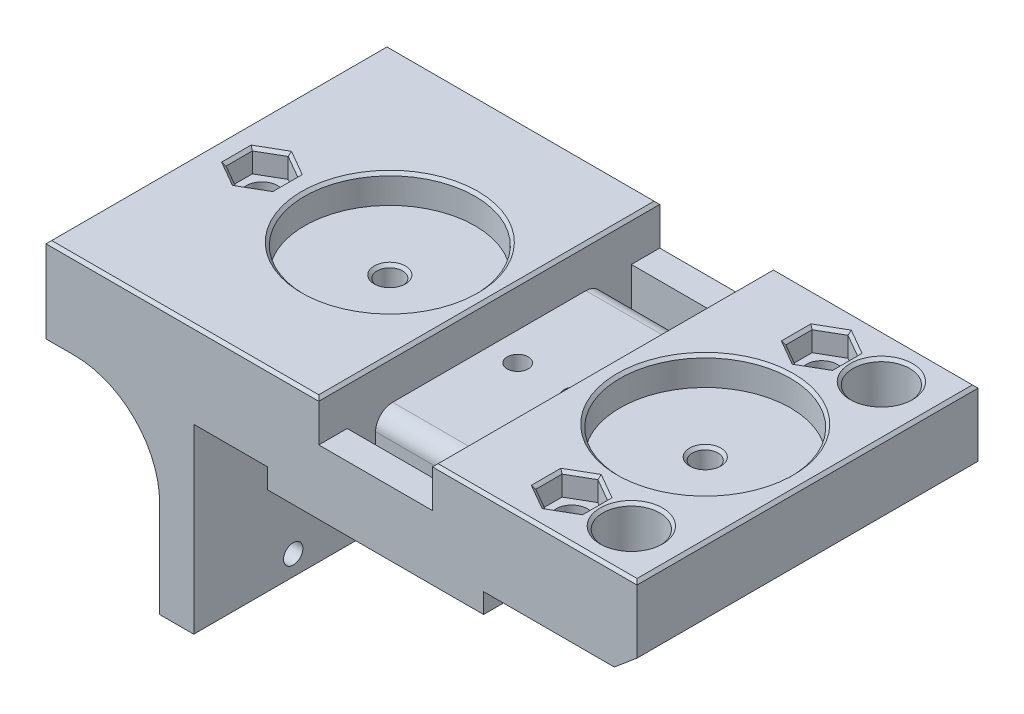
from build123d import *

# Parameters (mm, degrees)
SKETCH1_W                      = 84
SKETCH1_H                      = 60
BOSS_EXTRUDE1_DEPTH            = 15
SKETCH2_W                      = 6
SKETCH2_H                      = 60
BOSS_EXTRUDE2_DEPTH            = 32
M3_CLEARANCE_HOLE1_D           = 3.4
SKETCH7_W                      = 38
SKETCH7_H                      = 60
BOSS_EXTRUDE3_DEPTH            = 3.5
CUT_EXTRUDE5_START             = -7.147594
SKETCH26_W                     = 20
SKETCH26_H                     = 60
CUT_EXTRUDE5_DEPTH             = 7.147594
SKETCH30_W                     = 60
SKETCH30_H                     = 15
BOSS_EXTRUDE4_DEPTH            = 20
SKETCH27_W                     = 20
SKETCH27_H                     = 5
CUT_EXTRUDE6_DEPTH             = 111.653577801
FILLET1_R                      = 3
SKETCH28_R                     = 1.85
CUT_EXTRUDE7_DEPTH             = 111.653577801
CBORE_FOR_M5_SHCS2_D           = 5.5
CBORE_FOR_M5_SHCS2_CBORE_D     = 10
CBORE_FOR_M5_SHCS2_CBORE_DEPTH = 10
CHAMFER1_SIZE                  = 4
CHAMFER1_SIZE2                 = 3.356398525
CBORE_FOR_M5_SHCS3_D           = 5.5
CBORE_FOR_M5_SHCS3_CBORE_D     = 10
CBORE_FOR_M5_SHCS3_CBORE_DEPTH = 5
CUT_EXTRUDE8_DEPTH             = 4
CHAMFER2_SIZE                  = 0.5
SKETCH31_R                     = 15
CUT_EXTRUDE9_DEPTH             = 5
SKETCH32_R                     = 2.25
CUT_EXTRUDE10_DEPTH            = 112.445053726
CHAMFER3_SIZE                  = 0.5
FILLET2_R                      = 15
SKETCH33_R                     = 3
CUT_EXTRUDE11_DEPTH            = 109.074048744


with BuildPart() as part:
    # Sketch1 → Boss-Extrude1 (new body)
    with BuildSketch(Plane(origin=(0, 0, 0), x_dir=(1, 0, 0), z_dir=(0, 1, 0))):
        with Locations((42, 30)):
            Rectangle(SKETCH1_W, SKETCH1_H)
    extrude(amount=BOSS_EXTRUDE1_DEPTH)

    # Sketch2 → Boss-Extrude2 (add)
    with BuildSketch(Plane.XZ):
        with Locations((3, -30)):
            Rectangle(SKETCH2_W, SKETCH2_H)
    extrude(amount=BOSS_EXTRUDE2_DEPTH)

    # M3 Clearance Hole1 (through all)
    with Locations(Plane.ZY):
        with Locations((-42.5, -28.5), (-42.5, -3.5), (-17.5, -3.5), (-17.5, -28.5)):
            Hole(M3_CLEARANCE_HOLE1_D / 2)

    # Sketch7 → Boss-Extrude3 (add)
    with BuildSketch(Plane.XZ):
        with Locations((38, -30)):
            Rectangle(SKETCH7_W, SKETCH7_H)
    extrude(amount=BOSS_EXTRUDE3_DEPTH)

    # Sketch26 → Cut-Extrude5 (cut)
    with BuildSketch(Plane(origin=(0, 15, 0), x_dir=(1, 0, 0), z_dir=(0, 1, 0)).offset(CUT_EXTRUDE5_START)):
        with Locations((38, 30)):
            Rectangle(SKETCH26_W, SKETCH26_H)
    extrude(amount=CUT_EXTRUDE5_DEPTH, mode=Mode.SUBTRACT)

    # Sketch30 → Boss-Extrude4 (add)
    with BuildSketch(Plane.ZY):
        with Locations((-30, 7.5)):
            Rectangle(SKETCH30_W, SKETCH30_H)
    extrude(amount=BOSS_EXTRUDE4_DEPTH)

    # Sketch27 → Cut-Extrude6 (cut, through all)
    with BuildSketch(Plane(origin=(0, 7.852406202, 0), x_dir=(1, 0, 0), z_dir=(0, 1, 0))):
        with Locations((38, 7.5)):
            Rectangle(SKETCH27_W, SKETCH27_H)
        with Locations((38, 52.5)):
            Rectangle(SKETCH27_W, SKETCH27_H)
    extrude(amount=-CUT_EXTRUDE6_DEPTH, mode=Mode.SUBTRACT)

    # Fillet1
    fillet1_edges = [part.edges().sort_by_distance(p)[0] for p in [
        (38, -3.5, -5),
        (38, 7.852406202, -10),
        (38, -3.5, -55),
        (38, 7.852406202, -50),
    ]]
    fillet(fillet1_edges, radius=FILLET1_R)

    # Sketch28 → Cut-Extrude7 (cut, through all)
    with BuildSketch(Plane(origin=(0, 7.852406202, 0), x_dir=(1, 0, 0), z_dir=(0, 1, 0))):
        with Locations(Location((33, 30, 0), (0, 0, 270))):
            Circle(SKETCH28_R)
        with Locations(Location((43, 30, 0), (0, 0, 270))):
            Circle(SKETCH28_R)
    extrude(amount=-CUT_EXTRUDE7_DEPTH, mode=Mode.SUBTRACT)

    # CBORE for M5 SHCS2 (through all)
    with Locations(Plane(origin=(0, 15, 0), x_dir=(1, 0, 0), z_dir=(0, 1, 0))):
        with Locations((75, 52), (75, 8)):
            CounterBoreHole(CBORE_FOR_M5_SHCS2_D / 2, CBORE_FOR_M5_SHCS2_CBORE_D / 2, CBORE_FOR_M5_SHCS2_CBORE_DEPTH)

    # Chamfer1
    chamfer1_edges = [part.edges().sort_by_distance(p)[0] for p in [
        (84, 0, -30),
    ]]
    chamfer1_side = [part.faces().sort_by_distance(p)[0] for p in [
        (70.364021046, 0, -30),
    ]]
    chamfer(chamfer1_edges, length=CHAMFER1_SIZE, length2=CHAMFER1_SIZE2, reference=chamfer1_side[0])

    # CBORE for M5 SHCS3 (through all)
    with Locations(Plane(origin=(0, 0, 0), x_dir=(-1, 0, 0), z_dir=(0, -1, 0))):
        with Locations((-64.5, 52), (-64.5, 8), (12, 30)):
            CounterBoreHole(CBORE_FOR_M5_SHCS3_D / 2, CBORE_FOR_M5_SHCS3_CBORE_D / 2, CBORE_FOR_M5_SHCS3_CBORE_DEPTH)

    # Sketch20 → Cut-Extrude8 (cut)
    with BuildSketch(Plane(origin=(0, 15, 0), x_dir=(1, 0, 0), z_dir=(0, 1, 0))):
        Polygon((64.5, 12.618802154), (60.5, 10.309401077), (60.5, 5.690598923), (64.5, 3.381197846), (68.5, 5.690598923), (68.5, 10.309401077), align=None)
        Polygon((64.5, 47.381197846), (68.5, 49.690598923), (68.5, 54.309401077), (64.5, 56.618802154), (60.5, 54.309401077), (60.5, 49.690598923), align=None)
        Polygon((-8, 27.690598923), (-8, 32.309401077), (-12, 34.618802154), (-16, 32.309401077), (-16, 27.690598923), (-12, 25.381197846), align=None)
    extrude(amount=-CUT_EXTRUDE8_DEPTH, mode=Mode.SUBTRACT)

    # Chamfer2
    chamfer2_edges = [part.edges().sort_by_distance(p)[0] for p in [
        (84, 15, -30),
        (66, 15, -60),
        (70, 15, -8),
        (70, 15, -52),
        (66.5, 15, -11.464101615),
        (62.5, 15, -11.464101615),
        (60.5, 15, -8),
        (62.5, 15, -4.535898385),
        (66.5, 15, -4.535898385),
        (68.5, 15, -8),
        (62.5, 15, -48.535898385),
        (66.5, 15, -48.535898385),
        (68.5, 15, -52),
        (66.5, 15, -55.464101615),
        (62.5, 15, -55.464101615),
        (60.5, 15, -52),
        (-10, 15, -26.535898385),
        (-8, 15, -30),
        (-10, 15, -33.464101615),
        (-14, 15, -33.464101615),
        (-16, 15, -30),
        (-14, 15, -26.535898385),
        (66, 15, 0),
        (4, 15, -60),
        (28, 15, -30),
        (48, 15, -30),
        (-20, 15, -30),
        (4, 15, 0),
    ]]
    chamfer(chamfer2_edges, length=CHAMFER2_SIZE)

    # Sketch31 → Cut-Extrude9 (cut)
    with BuildSketch(Plane(origin=(0, 15, 0), x_dir=(1, 0, 0), z_dir=(0, 1, 0))):
        with Locations(Location((66, 30, 0), (0, 0, 270))):
            Circle(SKETCH31_R)
        with Locations(Location((10.5, 30, 0), (0, 0, 270))):
            Circle(SKETCH31_R)
    extrude(amount=-CUT_EXTRUDE9_DEPTH, mode=Mode.SUBTRACT)

    # Sketch32 → Cut-Extrude10 (cut, through all)
    with BuildSketch(Plane(origin=(0, 10, 0), x_dir=(1, 0, 0), z_dir=(0, 1, 0))):
        with Locations(Location((10.5, 30, 0), (0, 0, 270))):
            Circle(SKETCH32_R)
        with Locations(Location((66, 30, 0), (0, 0, 270))):
            Circle(SKETCH32_R)
    extrude(amount=-CUT_EXTRUDE10_DEPTH, mode=Mode.SUBTRACT)

    # Chamfer3
    chamfer3_edges = [part.edges().sort_by_distance(p)[0] for p in [
        (66, 15, -45),
        (10.5, 15, -45),
        (10.5, 10, -32.25),
        (66, 10, -32.25),
    ]]
    chamfer(chamfer3_edges, length=CHAMFER3_SIZE)

    # Fillet2
    # the kernel refuses this fillet: 15 mm, written as the material it adds along each edge
    with BuildSketch(Plane(origin=(0, 0, 0), x_dir=(-1, 0, 0), z_dir=(0, 0, -1))) as fillet2_piece_1_section:
        with BuildLine():
            CenterArc((FILLET2_R, -FILLET2_R), FILLET2_R, 90, 90)
            Line((0, -FILLET2_R), (0, 0))
            Line((0, 0), (FILLET2_R, 0))
        make_face()
    fillet2_piece_1 = extrude(amount=60, mode=Mode.PRIVATE)
    fillet2_piece_1 = fillet2_piece_1 - Plane(origin=(-12, -3.454719609, -30), x_dir=(-1, 0, 0), z_dir=(0, -1, 0)) * Cylinder(5, 180, mode=Mode.PRIVATE)
    fillet2_piece_1 = fillet2_piece_1 - Plane(origin=(-3.29371936, -3.5, -42.5), x_dir=(0, 0, -1), z_dir=(1, 0, 0)) * Cylinder(1.7, 180, mode=Mode.PRIVATE)
    fillet2_piece_1 = fillet2_piece_1 - Plane(origin=(-3.29371936, -3.5, -17.5), x_dir=(0, 0, -1), z_dir=(1, 0, 0)) * Cylinder(1.7, 180, mode=Mode.PRIVATE)
    add(fillet2_piece_1)

    # Sketch33 → Cut-Extrude11 (cut, through all)
    with BuildSketch(Plane.ZY):
        with Locations(Location((-17.5, -3.5, 0), (0, 0, 180))):
            Circle(SKETCH33_R)
        with Locations(Location((-42.5, -3.5, 0), (0, 0, 180))):
            Circle(SKETCH33_R)
    extrude(amount=CUT_EXTRUDE11_DEPTH, mode=Mode.SUBTRACT)


solid = part.part
